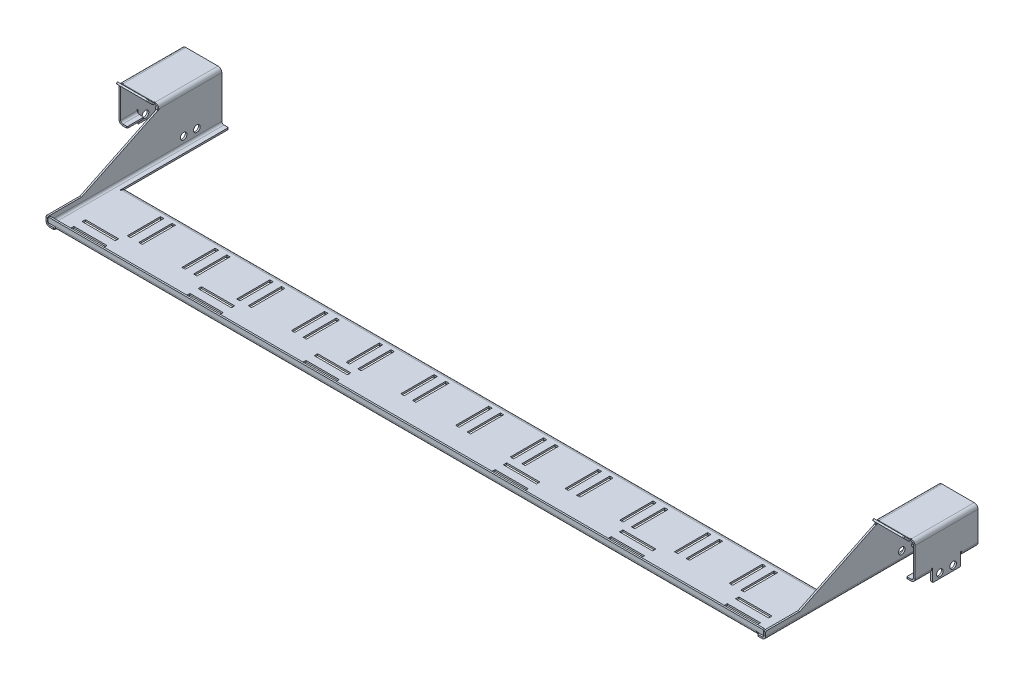
from build123d import *

# Parameters (mm, degrees)
BASE_FLANGE1_DEPTH              = 1
EDGE_FLANGE2_STRIP_W            = 6.6
EDGE_FLANGE2_STRIP_H            = 1
EDGE_FLANGE2_STRIP_CUT_DEPTH    = 105
EDGE_FLANGE2_STRIP_2_W          = 6.6
EDGE_FLANGE2_STRIP_2_H          = 1
EDGE_FLANGE2_STRIP_CUT_2_DEPTH  = 105
EDGE_FLANGE2_DEPTH              = 105
EDGE_FLANGE2_BEND_DEPTH         = 105
EDGE_FLANGE3_STRIP_W            = 6.6
EDGE_FLANGE3_STRIP_H            = 1
EDGE_FLANGE3_STRIP_CUT_DEPTH    = 38
EDGE_FLANGE3_RELIEF_W           = 7.1
EDGE_FLANGE3_RELIEF_H           = 0.5
EDGE_FLANGE3_RELIEF_CUT_DEPTH   = 1
EDGE_FLANGE3_STRIP_2_W          = 6.6
EDGE_FLANGE3_STRIP_2_H          = 1
EDGE_FLANGE3_STRIP_CUT_2_DEPTH  = 38
EDGE_FLANGE3_RELIEF_2_W         = 7.1
EDGE_FLANGE3_RELIEF_2_H         = 0.5
EDGE_FLANGE3_RELIEF_CUT_2_DEPTH = 1
EDGE_FLANGE3_DEPTH              = 38
EDGE_FLANGE3_BEND_DEPTH         = 38
EDGE_FLANGE4_STRIP_W            = 6.6
EDGE_FLANGE4_STRIP_H            = 1
EDGE_FLANGE4_STRIP_CUT_DEPTH    = 38
EDGE_FLANGE4_STRIP_2_W          = 6.6
EDGE_FLANGE4_STRIP_2_H          = 1
EDGE_FLANGE4_STRIP_CUT_2_DEPTH  = 38
EDGE_FLANGE4_DEPTH              = 38
EDGE_FLANGE4_BEND_DEPTH         = 38
SKETCH31_W                      = 0.5
SKETCH31_H                      = 1.5
CUT_EXTRUDE1_DEPTH              = 264.564033965
EDGE_FLANGE5_STRIP_W            = 6.6
EDGE_FLANGE5_STRIP_H            = 1
EDGE_FLANGE5_STRIP_CUT_DEPTH    = 423
EDGE_FLANGE5_RELIEF_W           = 7.1
EDGE_FLANGE5_RELIEF_H           = 0.5
EDGE_FLANGE5_RELIEF_CUT_DEPTH   = 1
EDGE_FLANGE5_DEPTH              = 423
SKETCH38_W                      = 0.5
SKETCH38_H                      = 1.5
CUT_EXTRUDE2_DEPTH              = 264.564033965
EDGE_FLANGE7_STRIP_W            = 6.6
EDGE_FLANGE7_STRIP_H            = 1
EDGE_FLANGE7_STRIP_CUT_DEPTH    = 423
EDGE_FLANGE7_RELIEF_W           = 7.1
EDGE_FLANGE7_RELIEF_H           = 0.5
EDGE_FLANGE7_RELIEF_CUT_DEPTH   = 1
EDGE_FLANGE7_DEPTH              = 423
CUT_EXTRUDE3_REACH              = 494.205
SKETCH42_W                      = 10.5
SKETCH42_H                      = 5
CUT_EXTRUDE4_REACH              = 494.205
SKETCH44_W                      = 0.5
SKETCH44_H                      = 1.5
EDGE_FLANGE8_STRIP_W            = 6.6
EDGE_FLANGE8_STRIP_H            = 1
EDGE_FLANGE8_STRIP_CUT_DEPTH    = 10
EDGE_FLANGE8_RELIEF_W           = 7.1
EDGE_FLANGE8_RELIEF_H           = 0.5
EDGE_FLANGE8_RELIEF_CUT_DEPTH   = 1
EDGE_FLANGE8_STRIP_2_W          = 6.6
EDGE_FLANGE8_STRIP_2_H          = 1
EDGE_FLANGE8_STRIP_CUT_2_DEPTH  = 10
EDGE_FLANGE8_RELIEF_2_W         = 7.1
EDGE_FLANGE8_RELIEF_2_H         = 0.5
EDGE_FLANGE8_RELIEF_CUT_2_DEPTH = 1
EDGE_FLANGE8_DEPTH              = 10
EDGE_FLANGE8_BEND_DEPTH         = 10
CUT_EXTRUDE5_REACH              = 494.205
SKETCH51_W                      = 10.5
SKETCH51_H                      = 5
CUT_EXTRUDE6_REACH              = 494.205
SKETCH52_W                      = 0.5
SKETCH52_H                      = 1.5
EDGE_FLANGE9_STRIP_W            = 6.6
EDGE_FLANGE9_STRIP_H            = 1
EDGE_FLANGE9_STRIP_CUT_DEPTH    = 10
EDGE_FLANGE9_RELIEF_W           = 7.1
EDGE_FLANGE9_RELIEF_H           = 0.5
EDGE_FLANGE9_RELIEF_CUT_DEPTH   = 1
EDGE_FLANGE9_STRIP_2_W          = 6.6
EDGE_FLANGE9_STRIP_2_H          = 1
EDGE_FLANGE9_STRIP_CUT_2_DEPTH  = 10
EDGE_FLANGE9_RELIEF_2_W         = 7.1
EDGE_FLANGE9_RELIEF_2_H         = 0.5
EDGE_FLANGE9_RELIEF_CUT_2_DEPTH = 1
EDGE_FLANGE9_DEPTH              = 10
EDGE_FLANGE9_BEND_DEPTH         = 10
CUT_EXTRUDE8_REACH              = 266.161
SKETCH67_W                      = 0.2
SKETCH67_H                      = 0.3
EDGE_FLANGE11_DEPTH             = 18.8
EDGE_FLANGE11_BEND_DEPTH        = 18.8
SKETCH73_R                      = 2
CUT_EXTRUDE9_DEPTH              = 493.406933215
CUT_EXTRUDE11_REACH             = 265.941
SKETCH75_W                      = 20
SKETCH75_H                      = 2
CUT_EXTRUDE13_REACH             = 472.014
FILLET1_R                       = 0.5
BOSS_EXTRUDE1_DEPTH             = 1
FILLET3_R                       = 0.5
CUT_EXTRUDE14_REACH             = 265.941
SKETCH80_W                      = 2
SKETCH80_H                      = 20


# Sheet-metal steps are written as plain solids
with BuildPart() as part:
    # Sketch1 → Base-Flange1 (new body)
    with BuildSketch(Plane(origin=(0, 0, 0), x_dir=(1, 0, 0), z_dir=(0, 1, 0))):
        Polygon((217, 0), (-217, 0), (-217, 105), (-212, 105), (-212, 42.5), (212, 42.5), (212, 105), (217, 105), align=None)
    extrude(amount=-BASE_FLANGE1_DEPTH)

    # Edge-Flange2 strip (across the edge) → Edge-Flange2 strip cut (cut)
    with BuildSketch(Plane(origin=(217, 0, 0), x_dir=(-1, 0, 0), z_dir=(0, 0, -1))):
        with Locations((-1, -0.5)):
            Rectangle(EDGE_FLANGE2_STRIP_W, EDGE_FLANGE2_STRIP_H)
    extrude(amount=EDGE_FLANGE2_STRIP_CUT_DEPTH, mode=Mode.SUBTRACT)

    # Edge-Flange2 strip 2 (across the edge) → Edge-Flange2 strip cut 2 (cut)
    with BuildSketch(Plane(origin=(-217, 0, -105), x_dir=(1, 0, 0), z_dir=(0, 0, 1))):
        with Locations((-1, -0.5)):
            Rectangle(EDGE_FLANGE2_STRIP_2_W, EDGE_FLANGE2_STRIP_2_H)
    extrude(amount=EDGE_FLANGE2_STRIP_CUT_2_DEPTH, mode=Mode.SUBTRACT)

    # Edge-Flange2 section (across the edge) → Edge-Flange2 (add)
    with BuildSketch(Plane(origin=(217, 0, 0), x_dir=(-1, 0, 0), z_dir=(0, 0, -1))):
        with BuildLine():
            Line((0, 1.3), (0, 29))
            Line((0, 29), (1, 29))
            Line((1, 29), (1, 1.3))
            ThreePointArc((1, 1.3), (1.380761184, 0.380761184), (2.3, 0))
            Line((2.3, 0), (2.3, -1))
            ThreePointArc((2.3, -1), (0.673654403, -0.326345597), (0, 1.3))
        make_face()
    extrude(amount=EDGE_FLANGE2_DEPTH)

    # Edge-Flange2 section 2 (across the edge) → Edge-Flange2 bend (add)
    with BuildSketch(Plane(origin=(-217, 0, -105), x_dir=(1, 0, 0), z_dir=(0, 0, 1))):
        with BuildLine():
            Line((0, 1.3), (0, 29))
            Line((0, 29), (1, 29))
            Line((1, 29), (1, 1.3))
            ThreePointArc((1, 1.3), (1.380761184, 0.380761184), (2.3, 0))
            Line((2.3, 0), (2.3, -1))
            ThreePointArc((2.3, -1), (0.673654403, -0.326345597), (0, 1.3))
        make_face()
    extrude(amount=EDGE_FLANGE2_BEND_DEPTH)

    # Edge-Flange3 strip (across the edge) → Edge-Flange3 strip cut (cut)
    with BuildSketch(Plane(origin=(217, 29, -105), x_dir=(0, -1, 0), z_dir=(0, 0, 1))):
        with Locations((-1, -0.5)):
            Rectangle(EDGE_FLANGE3_STRIP_W, EDGE_FLANGE3_STRIP_H)
    extrude(amount=EDGE_FLANGE3_STRIP_CUT_DEPTH, mode=Mode.SUBTRACT)

    # Edge-Flange3 relief (on the sheet) → Edge-Flange3 relief cut (cut)
    with BuildSketch(Plane(origin=(217, 26.7, -105), x_dir=(0, -1, 0), z_dir=(1, 0, 0))):
        with Locations((-3.05, -38.25)):
            Rectangle(EDGE_FLANGE3_RELIEF_W, EDGE_FLANGE3_RELIEF_H)
    extrude(amount=-EDGE_FLANGE3_RELIEF_CUT_DEPTH, mode=Mode.SUBTRACT)

    # Edge-Flange3 strip 2 (across the edge) → Edge-Flange3 strip cut 2 (cut)
    with BuildSketch(Plane(origin=(-217, 29, -67), x_dir=(0, -1, 0), z_dir=(0, 0, -1))):
        with Locations((-1, -0.5)):
            Rectangle(EDGE_FLANGE3_STRIP_2_W, EDGE_FLANGE3_STRIP_2_H)
    extrude(amount=EDGE_FLANGE3_STRIP_CUT_2_DEPTH, mode=Mode.SUBTRACT)

    # Edge-Flange3 relief 2 (on the sheet) → Edge-Flange3 relief cut 2 (cut)
    with BuildSketch(Plane(origin=(-217, 26.7, -67), x_dir=(0, -1, 0), z_dir=(-1, 0, 0))):
        with Locations((-3.05, 0.25)):
            Rectangle(EDGE_FLANGE3_RELIEF_2_W, EDGE_FLANGE3_RELIEF_2_H)
    extrude(amount=-EDGE_FLANGE3_RELIEF_CUT_2_DEPTH, mode=Mode.SUBTRACT)

    # Edge-Flange3 section (across the edge) → Edge-Flange3 (add)
    with BuildSketch(Plane(origin=(217, 29, -105), x_dir=(0, -1, 0), z_dir=(0, 0, 1))):
        with BuildLine():
            Line((0, 1.3), (0, 23))
            Line((0, 23), (1, 23))
            Line((1, 23), (1, 1.3))
            ThreePointArc((1, 1.3), (1.380761184, 0.380761184), (2.3, 0))
            Line((2.3, 0), (2.3, -1))
            ThreePointArc((2.3, -1), (0.673654403, -0.326345597), (0, 1.3))
        make_face()
    extrude(amount=EDGE_FLANGE3_DEPTH)

    # Edge-Flange3 section 2 (across the edge) → Edge-Flange3 bend (add)
    with BuildSketch(Plane(origin=(-217, 29, -67), x_dir=(0, -1, 0), z_dir=(0, 0, -1))):
        with BuildLine():
            Line((0, 1.3), (0, 23))
            Line((0, 23), (1, 23))
            Line((1, 23), (1, 1.3))
            ThreePointArc((1, 1.3), (1.380761184, 0.380761184), (2.3, 0))
            Line((2.3, 0), (2.3, -1))
            ThreePointArc((2.3, -1), (0.673654403, -0.326345597), (0, 1.3))
        make_face()
    extrude(amount=EDGE_FLANGE3_BEND_DEPTH)

    # Edge-Flange4 strip (across the edge) → Edge-Flange4 strip cut (cut)
    with BuildSketch(Plane(origin=(240, 28, -105), x_dir=(-1, 0, 0), z_dir=(0, 0, 1))):
        with Locations((-1, -0.5)):
            Rectangle(EDGE_FLANGE4_STRIP_W, EDGE_FLANGE4_STRIP_H)
    extrude(amount=EDGE_FLANGE4_STRIP_CUT_DEPTH, mode=Mode.SUBTRACT)

    # Edge-Flange4 strip 2 (across the edge) → Edge-Flange4 strip cut 2 (cut)
    with BuildSketch(Plane(origin=(-240, 28, -67), x_dir=(1, 0, 0), z_dir=(0, 0, -1))):
        with Locations((-1, -0.5)):
            Rectangle(EDGE_FLANGE4_STRIP_2_W, EDGE_FLANGE4_STRIP_2_H)
    extrude(amount=EDGE_FLANGE4_STRIP_CUT_2_DEPTH, mode=Mode.SUBTRACT)

    # Edge-Flange4 section (across the edge) → Edge-Flange4 (add)
    with BuildSketch(Plane(origin=(240, 28, -105), x_dir=(-1, 0, 0), z_dir=(0, 0, 1))):
        with BuildLine():
            Line((0, 1.3), (0, 26))
            Line((0, 26), (1, 26))
            Line((1, 26), (1, 1.3))
            ThreePointArc((1, 1.3), (1.380761184, 0.380761184), (2.3, 0))
            Line((2.3, 0), (2.3, -1))
            ThreePointArc((2.3, -1), (0.673654403, -0.326345597), (0, 1.3))
        make_face()
    extrude(amount=EDGE_FLANGE4_DEPTH)

    # Edge-Flange4 section 2 (across the edge) → Edge-Flange4 bend (add)
    with BuildSketch(Plane(origin=(-240, 28, -67), x_dir=(1, 0, 0), z_dir=(0, 0, -1))):
        with BuildLine():
            Line((0, 1.3), (0, 26))
            Line((0, 26), (1, 26))
            Line((1, 26), (1, 1.3))
            ThreePointArc((1, 1.3), (1.380761184, 0.380761184), (2.3, 0))
            Line((2.3, 0), (2.3, -1))
            ThreePointArc((2.3, -1), (0.673654403, -0.326345597), (0, 1.3))
        make_face()
    extrude(amount=EDGE_FLANGE4_BEND_DEPTH)

    # Sketch31 → Cut-Extrude1 (cut, through all)
    with BuildSketch(Plane(origin=(0, 0, 0), x_dir=(1, 0, 0), z_dir=(0, 1, 0))):
        with Locations((-211.75, 41.75)):
            Rectangle(SKETCH31_W, SKETCH31_H)
        with Locations((211.75, 41.75)):
            Rectangle(SKETCH31_W, SKETCH31_H)
    extrude(amount=-CUT_EXTRUDE1_DEPTH, mode=Mode.SUBTRACT)

    # Edge-Flange5 strip (across the edge) → Edge-Flange5 strip cut (cut)
    with BuildSketch(Plane(origin=(-211.5, -1, -42.5), x_dir=(0, 0, 1), z_dir=(1, 0, 0))):
        with Locations((-1, -0.5)):
            Rectangle(EDGE_FLANGE5_STRIP_W, EDGE_FLANGE5_STRIP_H)
    extrude(amount=EDGE_FLANGE5_STRIP_CUT_DEPTH, mode=Mode.SUBTRACT)

    # Edge-Flange5 relief (on the sheet) → Edge-Flange5 relief cut (cut)
    with BuildSketch(Plane(origin=(-211.5, -1, -40.2), x_dir=(0, 0, 1), z_dir=(0, -1, 0))):
        with Locations((-3.05, 0.25)):
            Rectangle(EDGE_FLANGE5_RELIEF_W, EDGE_FLANGE5_RELIEF_H)
        with Locations((-3.05, -423.25)):
            Rectangle(EDGE_FLANGE5_RELIEF_W, EDGE_FLANGE5_RELIEF_H)
    extrude(amount=-EDGE_FLANGE5_RELIEF_CUT_DEPTH, mode=Mode.SUBTRACT)

    # Edge-Flange5 section (across the edge) → Edge-Flange5 (add)
    with BuildSketch(Plane(origin=(-211.5, -1, -42.5), x_dir=(0, 0, 1), z_dir=(1, 0, 0))):
        with BuildLine():
            Line((0, 1.3), (0, 4))
            Line((0, 4), (1, 4))
            Line((1, 4), (1, 1.3))
            ThreePointArc((1, 1.3), (1.380761184, 0.380761184), (2.3, 0))
            Line((2.3, 0), (2.3, -1))
            ThreePointArc((2.3, -1), (0.673654403, -0.326345597), (0, 1.3))
        make_face()
    extrude(amount=EDGE_FLANGE5_DEPTH)

    # Sketch38 → Cut-Extrude2 (cut, through all)
    with BuildSketch(Plane(origin=(0, 0, 0), x_dir=(1, 0, 0), z_dir=(0, 1, 0))):
        with Locations((-211.75, 0.75)):
            Rectangle(SKETCH38_W, SKETCH38_H)
        with Locations((211.75, 0.75)):
            Rectangle(SKETCH38_W, SKETCH38_H)
    extrude(amount=-CUT_EXTRUDE2_DEPTH, mode=Mode.SUBTRACT)

    # Edge-Flange7 strip (across the edge) → Edge-Flange7 strip cut (cut)
    with BuildSketch(Plane(origin=(-211.5, 0, 0), x_dir=(0, 0, -1), z_dir=(1, 0, 0))):
        with Locations((-1, -0.5)):
            Rectangle(EDGE_FLANGE7_STRIP_W, EDGE_FLANGE7_STRIP_H)
    extrude(amount=EDGE_FLANGE7_STRIP_CUT_DEPTH, mode=Mode.SUBTRACT)

    # Edge-Flange7 relief (on the sheet) → Edge-Flange7 relief cut (cut)
    with BuildSketch(Plane(origin=(-211.5, 0, -2.3), x_dir=(0, 0, -1), z_dir=(0, 1, 0))):
        with Locations((-3.05, 0.25)):
            Rectangle(EDGE_FLANGE7_RELIEF_W, EDGE_FLANGE7_RELIEF_H)
        with Locations((-3.05, -423.25)):
            Rectangle(EDGE_FLANGE7_RELIEF_W, EDGE_FLANGE7_RELIEF_H)
    extrude(amount=-EDGE_FLANGE7_RELIEF_CUT_DEPTH, mode=Mode.SUBTRACT)

    # Edge-Flange7 section (across the edge) → Edge-Flange7 (add)
    with BuildSketch(Plane(origin=(-211.5, 0, 0), x_dir=(0, 0, -1), z_dir=(1, 0, 0))):
        with BuildLine():
            Line((0, 1.3), (0, 4))
            Line((0, 4), (1, 4))
            Line((1, 4), (1, 1.3))
            ThreePointArc((1, 1.3), (1.380761184, 0.380761184), (2.3, 0))
            Line((2.3, 0), (2.3, -1))
            ThreePointArc((2.3, -1), (0.673654403, -0.326345597), (0, 1.3))
        make_face()
    extrude(amount=EDGE_FLANGE7_DEPTH)

    # Sketch42 → Cut-Extrude3 (cut, up to next)
    with BuildSketch(Plane.ZY.offset(240), mode=Mode.PRIVATE) as cut_extrude3_sk1:
        with Locations((-99.75, 4.5)):
            Rectangle(SKETCH42_W, SKETCH42_H)
    cut_extrude3_tool1 = extrude(cut_extrude3_sk1.sketch, amount=-CUT_EXTRUDE3_REACH, mode=Mode.PRIVATE) & part.part
    # Sketch42 → Cut-Extrude3 (cut, up to next)
    with BuildSketch(Plane.ZY.offset(240), mode=Mode.PRIVATE) as cut_extrude3_sk2:
        with Locations((-72.25, 4.5)):
            Rectangle(SKETCH42_W, SKETCH42_H)
    cut_extrude3_tool2 = extrude(cut_extrude3_sk2.sketch, amount=-CUT_EXTRUDE3_REACH, mode=Mode.PRIVATE) & part.part
    add(cut_extrude3_tool1.solids().sort_by_distance((-240, 4.5, -99.75))[0], mode=Mode.SUBTRACT)
    add(cut_extrude3_tool2.solids().sort_by_distance((-240, 4.5, -72.25))[0], mode=Mode.SUBTRACT)

    # Sketch44 → Cut-Extrude4 (cut, up to next)
    with BuildSketch(Plane.ZY.offset(240), mode=Mode.PRIVATE) as cut_extrude4_sk1:
        with Locations((-94.75, 7.75)):
            Rectangle(SKETCH44_W, SKETCH44_H)
    cut_extrude4_tool1 = extrude(cut_extrude4_sk1.sketch, amount=-CUT_EXTRUDE4_REACH, mode=Mode.PRIVATE) & part.part
    # Sketch44 → Cut-Extrude4 (cut, up to next)
    with BuildSketch(Plane.ZY.offset(240), mode=Mode.PRIVATE) as cut_extrude4_sk2:
        with Locations((-77.25, 7.75)):
            Rectangle(SKETCH44_W, SKETCH44_H)
    cut_extrude4_tool2 = extrude(cut_extrude4_sk2.sketch, amount=-CUT_EXTRUDE4_REACH, mode=Mode.PRIVATE) & part.part
    add(cut_extrude4_tool1.solids().sort_by_distance((-240, 7.75, -94.75))[0], mode=Mode.SUBTRACT)
    add(cut_extrude4_tool2.solids().sort_by_distance((-240, 7.75, -77.25))[0], mode=Mode.SUBTRACT)

    # Edge-Flange8 strip (across the edge) → Edge-Flange8 strip cut (cut)
    with BuildSketch(Plane(origin=(-239, 7, -95), x_dir=(0, 1, 0), z_dir=(0, 0, -1))):
        with Locations((-1, -0.5)):
            Rectangle(EDGE_FLANGE8_STRIP_W, EDGE_FLANGE8_STRIP_H)
    extrude(amount=EDGE_FLANGE8_STRIP_CUT_DEPTH, mode=Mode.SUBTRACT)

    # Edge-Flange8 relief (on the sheet) → Edge-Flange8 relief cut (cut)
    with BuildSketch(Plane(origin=(-239, 9.3, -95), x_dir=(0, 1, 0), z_dir=(1, 0, 0))):
        with Locations((-3.05, 0.25)):
            Rectangle(EDGE_FLANGE8_RELIEF_W, EDGE_FLANGE8_RELIEF_H)
    extrude(amount=-EDGE_FLANGE8_RELIEF_CUT_DEPTH, mode=Mode.SUBTRACT)

    # Edge-Flange8 strip 2 (across the edge) → Edge-Flange8 strip cut 2 (cut)
    with BuildSketch(Plane(origin=(-239, 7, -67), x_dir=(0, 1, 0), z_dir=(0, 0, -1))):
        with Locations((-1, -0.5)):
            Rectangle(EDGE_FLANGE8_STRIP_2_W, EDGE_FLANGE8_STRIP_2_H)
    extrude(amount=EDGE_FLANGE8_STRIP_CUT_2_DEPTH, mode=Mode.SUBTRACT)

    # Edge-Flange8 relief 2 (on the sheet) → Edge-Flange8 relief cut 2 (cut)
    with BuildSketch(Plane(origin=(-239, 9.3, -67), x_dir=(0, 1, 0), z_dir=(1, 0, 0))):
        with Locations((-3.05, -10.25)):
            Rectangle(EDGE_FLANGE8_RELIEF_2_W, EDGE_FLANGE8_RELIEF_2_H)
    extrude(amount=-EDGE_FLANGE8_RELIEF_CUT_2_DEPTH, mode=Mode.SUBTRACT)

    # Edge-Flange8 section (across the edge) → Edge-Flange8 (add)
    with BuildSketch(Plane(origin=(-239, 7, -95), x_dir=(0, 1, 0), z_dir=(0, 0, -1))):
        with BuildLine():
            Line((0, 1.3), (0, 4))
            Line((0, 4), (1, 4))
            Line((1, 4), (1, 1.3))
            ThreePointArc((1, 1.3), (1.380761184, 0.380761184), (2.3, 0))
            Line((2.3, 0), (2.3, -1))
            ThreePointArc((2.3, -1), (0.673654403, -0.326345597), (0, 1.3))
        make_face()
    extrude(amount=EDGE_FLANGE8_DEPTH)

    # Edge-Flange8 section 2 (across the edge) → Edge-Flange8 bend (add)
    with BuildSketch(Plane(origin=(-239, 7, -67), x_dir=(0, 1, 0), z_dir=(0, 0, -1))):
        with BuildLine():
            Line((0, 1.3), (0, 4))
            Line((0, 4), (1, 4))
            Line((1, 4), (1, 1.3))
            ThreePointArc((1, 1.3), (1.380761184, 0.380761184), (2.3, 0))
            Line((2.3, 0), (2.3, -1))
            ThreePointArc((2.3, -1), (0.673654403, -0.326345597), (0, 1.3))
        make_face()
    extrude(amount=EDGE_FLANGE8_BEND_DEPTH)

    # Sketch51 → Cut-Extrude5 (cut, up to next)
    with BuildSketch(Plane(origin=(240, 0, 0), x_dir=(0, 0, -1), z_dir=(1, 0, 0)), mode=Mode.PRIVATE) as cut_extrude5_sk1:
        with Locations((72.25, 4.5)):
            Rectangle(SKETCH51_W, SKETCH51_H)
    cut_extrude5_tool1 = extrude(cut_extrude5_sk1.sketch, amount=-CUT_EXTRUDE5_REACH, mode=Mode.PRIVATE) & part.part
    # Sketch51 → Cut-Extrude5 (cut, up to next)
    with BuildSketch(Plane(origin=(240, 0, 0), x_dir=(0, 0, -1), z_dir=(1, 0, 0)), mode=Mode.PRIVATE) as cut_extrude5_sk2:
        with Locations((99.75, 4.5)):
            Rectangle(SKETCH51_W, SKETCH51_H)
    cut_extrude5_tool2 = extrude(cut_extrude5_sk2.sketch, amount=-CUT_EXTRUDE5_REACH, mode=Mode.PRIVATE) & part.part
    add(cut_extrude5_tool1.solids().sort_by_distance((240, 4.5, -72.25))[0], mode=Mode.SUBTRACT)
    add(cut_extrude5_tool2.solids().sort_by_distance((240, 4.5, -99.75))[0], mode=Mode.SUBTRACT)

    # Sketch52 → Cut-Extrude6 (cut, up to next)
    with BuildSketch(Plane(origin=(240, 0, 0), x_dir=(0, 0, -1), z_dir=(1, 0, 0)), mode=Mode.PRIVATE) as cut_extrude6_sk1:
        with Locations((77.25, 7.75)):
            Rectangle(SKETCH52_W, SKETCH52_H)
    cut_extrude6_tool1 = extrude(cut_extrude6_sk1.sketch, amount=-CUT_EXTRUDE6_REACH, mode=Mode.PRIVATE) & part.part
    # Sketch52 → Cut-Extrude6 (cut, up to next)
    with BuildSketch(Plane(origin=(240, 0, 0), x_dir=(0, 0, -1), z_dir=(1, 0, 0)), mode=Mode.PRIVATE) as cut_extrude6_sk2:
        with Locations((94.75, 7.75)):
            Rectangle(SKETCH52_W, SKETCH52_H)
    cut_extrude6_tool2 = extrude(cut_extrude6_sk2.sketch, amount=-CUT_EXTRUDE6_REACH, mode=Mode.PRIVATE) & part.part
    add(cut_extrude6_tool1.solids().sort_by_distance((240, 7.75, -77.25))[0], mode=Mode.SUBTRACT)
    add(cut_extrude6_tool2.solids().sort_by_distance((240, 7.75, -94.75))[0], mode=Mode.SUBTRACT)

    # Edge-Flange9 strip (across the edge) → Edge-Flange9 strip cut (cut)
    with BuildSketch(Plane(origin=(239, 7, -77), x_dir=(0, 1, 0), z_dir=(0, 0, 1))):
        with Locations((-1, -0.5)):
            Rectangle(EDGE_FLANGE9_STRIP_W, EDGE_FLANGE9_STRIP_H)
    extrude(amount=EDGE_FLANGE9_STRIP_CUT_DEPTH, mode=Mode.SUBTRACT)

    # Edge-Flange9 relief (on the sheet) → Edge-Flange9 relief cut (cut)
    with BuildSketch(Plane(origin=(239, 9.3, -77), x_dir=(0, 1, 0), z_dir=(-1, 0, 0))):
        with Locations((-3.05, 0.25)):
            Rectangle(EDGE_FLANGE9_RELIEF_W, EDGE_FLANGE9_RELIEF_H)
    extrude(amount=-EDGE_FLANGE9_RELIEF_CUT_DEPTH, mode=Mode.SUBTRACT)

    # Edge-Flange9 strip 2 (across the edge) → Edge-Flange9 strip cut 2 (cut)
    with BuildSketch(Plane(origin=(239, 7, -105), x_dir=(0, 1, 0), z_dir=(0, 0, 1))):
        with Locations((-1, -0.5)):
            Rectangle(EDGE_FLANGE9_STRIP_2_W, EDGE_FLANGE9_STRIP_2_H)
    extrude(amount=EDGE_FLANGE9_STRIP_CUT_2_DEPTH, mode=Mode.SUBTRACT)

    # Edge-Flange9 relief 2 (on the sheet) → Edge-Flange9 relief cut 2 (cut)
    with BuildSketch(Plane(origin=(239, 9.3, -105), x_dir=(0, 1, 0), z_dir=(-1, 0, 0))):
        with Locations((-3.05, -10.25)):
            Rectangle(EDGE_FLANGE9_RELIEF_2_W, EDGE_FLANGE9_RELIEF_2_H)
    extrude(amount=-EDGE_FLANGE9_RELIEF_CUT_2_DEPTH, mode=Mode.SUBTRACT)

    # Edge-Flange9 section (across the edge) → Edge-Flange9 (add)
    with BuildSketch(Plane(origin=(239, 7, -77), x_dir=(0, 1, 0), z_dir=(0, 0, 1))):
        with BuildLine():
            Line((0, 1.3), (0, 4))
            Line((0, 4), (1, 4))
            Line((1, 4), (1, 1.3))
            ThreePointArc((1, 1.3), (1.380761184, 0.380761184), (2.3, 0))
            Line((2.3, 0), (2.3, -1))
            ThreePointArc((2.3, -1), (0.673654403, -0.326345597), (0, 1.3))
        make_face()
    extrude(amount=EDGE_FLANGE9_DEPTH)

    # Edge-Flange9 section 2 (across the edge) → Edge-Flange9 bend (add)
    with BuildSketch(Plane(origin=(239, 7, -105), x_dir=(0, 1, 0), z_dir=(0, 0, 1))):
        with BuildLine():
            Line((0, 1.3), (0, 4))
            Line((0, 4), (1, 4))
            Line((1, 4), (1, 1.3))
            ThreePointArc((1, 1.3), (1.380761184, 0.380761184), (2.3, 0))
            Line((2.3, 0), (2.3, -1))
            ThreePointArc((2.3, -1), (0.673654403, -0.326345597), (0, 1.3))
        make_face()
    extrude(amount=EDGE_FLANGE9_BEND_DEPTH)

    # Sketch67 → Cut-Extrude8 (cut, up to next)
    with BuildSketch(Plane(origin=(0, 29, 0), x_dir=(1, 0, 0), z_dir=(0, 1, 0)), mode=Mode.PRIVATE) as cut_extrude8_sk1:
        with Locations((-237.5, 67.15)):
            Rectangle(SKETCH67_W, SKETCH67_H)
    cut_extrude8_tool1 = extrude(cut_extrude8_sk1.sketch, amount=-CUT_EXTRUDE8_REACH, mode=Mode.PRIVATE) & part.part
    # Sketch67 → Cut-Extrude8 (cut, up to next)
    with BuildSketch(Plane(origin=(0, 29, 0), x_dir=(1, 0, 0), z_dir=(0, 1, 0)), mode=Mode.PRIVATE) as cut_extrude8_sk2:
        with Locations((-218.5, 67.15)):
            Rectangle(SKETCH67_W, SKETCH67_H)
    cut_extrude8_tool2 = extrude(cut_extrude8_sk2.sketch, amount=-CUT_EXTRUDE8_REACH, mode=Mode.PRIVATE) & part.part
    # Sketch67 → Cut-Extrude8 (cut, up to next)
    with BuildSketch(Plane(origin=(0, 29, 0), x_dir=(1, 0, 0), z_dir=(0, 1, 0)), mode=Mode.PRIVATE) as cut_extrude8_sk3:
        with Locations((218.5, 67.15)):
            Rectangle(SKETCH67_W, SKETCH67_H)
    cut_extrude8_tool3 = extrude(cut_extrude8_sk3.sketch, amount=-CUT_EXTRUDE8_REACH, mode=Mode.PRIVATE) & part.part
    # Sketch67 → Cut-Extrude8 (cut, up to next)
    with BuildSketch(Plane(origin=(0, 29, 0), x_dir=(1, 0, 0), z_dir=(0, 1, 0)), mode=Mode.PRIVATE) as cut_extrude8_sk4:
        with Locations((237.5, 67.15)):
            Rectangle(SKETCH67_W, SKETCH67_H)
    cut_extrude8_tool4 = extrude(cut_extrude8_sk4.sketch, amount=-CUT_EXTRUDE8_REACH, mode=Mode.PRIVATE) & part.part
    add(cut_extrude8_tool1.solids().sort_by_distance((-237.5, 29, -67.15))[0], mode=Mode.SUBTRACT)
    add(cut_extrude8_tool2.solids().sort_by_distance((-218.5, 29, -67.15))[0], mode=Mode.SUBTRACT)
    add(cut_extrude8_tool3.solids().sort_by_distance((218.5, 29, -67.15))[0], mode=Mode.SUBTRACT)
    add(cut_extrude8_tool4.solids().sort_by_distance((237.5, 29, -67.15))[0], mode=Mode.SUBTRACT)

    # Edge-Flange11 section (across the edge) → Edge-Flange11 (add)
    with BuildSketch(Plane(origin=(-237.4, 29, -66.461522369), x_dir=(0, 0.7071067811865512, -0.7071067811865438), z_dir=(1, 0, 0))):
        with BuildLine():
            Line((-1, 0.538477631), (-1, 4.585786438))
            Line((-1, 4.585786438), (0, 4.585786438))
            Line((0, 4.585786438), (0, 0.538477631))
            ThreePointArc((0, 0.538477631), (0.098956608, 0.040989169), (0.380761184, -0.380761184))
            Line((0.380761184, -0.380761184), (-0.326345597, -1.087867966))
            ThreePointArc((-0.326345597, -1.087867966), (-0.824922925, -0.341694263), (-1, 0.538477631))
        make_face()
    extrude(amount=EDGE_FLANGE11_DEPTH)

    # Edge-Flange11 section 2 (across the edge) → Edge-Flange11 bend (add)
    with BuildSketch(Plane(origin=(218.6, 29, -66.461522369), x_dir=(0, 0.7071067811865512, -0.7071067811865438), z_dir=(1, 0, 0))):
        with BuildLine():
            Line((-1, 0.538477631), (-1, 4.585786438))
            Line((-1, 4.585786438), (0, 4.585786438))
            Line((0, 4.585786438), (0, 0.538477631))
            ThreePointArc((0, 0.538477631), (0.098956608, 0.040989169), (0.380761184, -0.380761184))
            Line((0.380761184, -0.380761184), (-0.326345597, -1.087867966))
            ThreePointArc((-0.326345597, -1.087867966), (-0.824922925, -0.341694263), (-1, 0.538477631))
        make_face()
    extrude(amount=EDGE_FLANGE11_BEND_DEPTH)

    # Sketch73 → Cut-Extrude9 (cut, through all)
    with BuildSketch(Plane.ZY.offset(240)):
        with Locations(Location((-90, 5, 0), (0, 0, 270))):
            Circle(SKETCH73_R)
        with Locations(Location((-82, 5, 0), (0, 0, 270))):
            Circle(SKETCH73_R)
    extrude(amount=-CUT_EXTRUDE9_DEPTH, mode=Mode.SUBTRACT)

    # Sketch75 → Cut-Extrude11 (cut, up to next)
    with BuildSketch(Plane(origin=(0, 0, 0), x_dir=(1, 0, 0), z_dir=(0, 1, 0)), mode=Mode.PRIVATE) as cut_extrude11_sk1:
        with Locations((-197, 12.8)):
            Rectangle(SKETCH75_W, SKETCH75_H)
    cut_extrude11_tool1 = extrude(cut_extrude11_sk1.sketch, amount=-CUT_EXTRUDE11_REACH, mode=Mode.PRIVATE) & part.part
    # Sketch75 → Cut-Extrude11 (cut, up to next)
    with BuildSketch(Plane(origin=(0, 0, 0), x_dir=(1, 0, 0), z_dir=(0, 1, 0)), mode=Mode.PRIVATE) as cut_extrude11_sk2:
        with Locations((-127, 12.8)):
            Rectangle(SKETCH75_W, SKETCH75_H)
    cut_extrude11_tool2 = extrude(cut_extrude11_sk2.sketch, amount=-CUT_EXTRUDE11_REACH, mode=Mode.PRIVATE) & part.part
    # Sketch75 → Cut-Extrude11 (cut, up to next)
    with BuildSketch(Plane(origin=(0, 0, 0), x_dir=(1, 0, 0), z_dir=(0, 1, 0)), mode=Mode.PRIVATE) as cut_extrude11_sk3:
        with Locations((-57, 12.8)):
            Rectangle(SKETCH75_W, SKETCH75_H)
    cut_extrude11_tool3 = extrude(cut_extrude11_sk3.sketch, amount=-CUT_EXTRUDE11_REACH, mode=Mode.PRIVATE) & part.part
    # Sketch75 → Cut-Extrude11 (cut, up to next)
    with BuildSketch(Plane(origin=(0, 0, 0), x_dir=(1, 0, 0), z_dir=(0, 1, 0)), mode=Mode.PRIVATE) as cut_extrude11_sk4:
        with Locations((57, 12.8)):
            Rectangle(SKETCH75_W, SKETCH75_H)
    cut_extrude11_tool4 = extrude(cut_extrude11_sk4.sketch, amount=-CUT_EXTRUDE11_REACH, mode=Mode.PRIVATE) & part.part
    # Sketch75 → Cut-Extrude11 (cut, up to next)
    with BuildSketch(Plane(origin=(0, 0, 0), x_dir=(1, 0, 0), z_dir=(0, 1, 0)), mode=Mode.PRIVATE) as cut_extrude11_sk5:
        with Locations((127, 12.8)):
            Rectangle(SKETCH75_W, SKETCH75_H)
    cut_extrude11_tool5 = extrude(cut_extrude11_sk5.sketch, amount=-CUT_EXTRUDE11_REACH, mode=Mode.PRIVATE) & part.part
    # Sketch75 → Cut-Extrude11 (cut, up to next)
    with BuildSketch(Plane(origin=(0, 0, 0), x_dir=(1, 0, 0), z_dir=(0, 1, 0)), mode=Mode.PRIVATE) as cut_extrude11_sk6:
        with Locations((197, 12.8)):
            Rectangle(SKETCH75_W, SKETCH75_H)
    cut_extrude11_tool6 = extrude(cut_extrude11_sk6.sketch, amount=-CUT_EXTRUDE11_REACH, mode=Mode.PRIVATE) & part.part
    # Sketch75 → Cut-Extrude11 (cut, up to next)
    with BuildSketch(Plane(origin=(0, 0, 0), x_dir=(1, 0, 0), z_dir=(0, 1, 0)), mode=Mode.PRIVATE) as cut_extrude11_sk7:
        with Locations((-197, 5.8)):
            Rectangle(SKETCH75_W, SKETCH75_H)
    cut_extrude11_tool7 = extrude(cut_extrude11_sk7.sketch, amount=-CUT_EXTRUDE11_REACH, mode=Mode.PRIVATE) & part.part
    # Sketch75 → Cut-Extrude11 (cut, up to next)
    with BuildSketch(Plane(origin=(0, 0, 0), x_dir=(1, 0, 0), z_dir=(0, 1, 0)), mode=Mode.PRIVATE) as cut_extrude11_sk8:
        with Locations((-127, 5.8)):
            Rectangle(SKETCH75_W, SKETCH75_H)
    cut_extrude11_tool8 = extrude(cut_extrude11_sk8.sketch, amount=-CUT_EXTRUDE11_REACH, mode=Mode.PRIVATE) & part.part
    # Sketch75 → Cut-Extrude11 (cut, up to next)
    with BuildSketch(Plane(origin=(0, 0, 0), x_dir=(1, 0, 0), z_dir=(0, 1, 0)), mode=Mode.PRIVATE) as cut_extrude11_sk9:
        with Locations((-57, 5.8)):
            Rectangle(SKETCH75_W, SKETCH75_H)
    cut_extrude11_tool9 = extrude(cut_extrude11_sk9.sketch, amount=-CUT_EXTRUDE11_REACH, mode=Mode.PRIVATE) & part.part
    # Sketch75 → Cut-Extrude11 (cut, up to next)
    with BuildSketch(Plane(origin=(0, 0, 0), x_dir=(1, 0, 0), z_dir=(0, 1, 0)), mode=Mode.PRIVATE) as cut_extrude11_sk10:
        with Locations((57, 5.8)):
            Rectangle(SKETCH75_W, SKETCH75_H)
    cut_extrude11_tool10 = extrude(cut_extrude11_sk10.sketch, amount=-CUT_EXTRUDE11_REACH, mode=Mode.PRIVATE) & part.part
    # Sketch75 → Cut-Extrude11 (cut, up to next)
    with BuildSketch(Plane(origin=(0, 0, 0), x_dir=(1, 0, 0), z_dir=(0, 1, 0)), mode=Mode.PRIVATE) as cut_extrude11_sk11:
        with Locations((127, 5.8)):
            Rectangle(SKETCH75_W, SKETCH75_H)
    cut_extrude11_tool11 = extrude(cut_extrude11_sk11.sketch, amount=-CUT_EXTRUDE11_REACH, mode=Mode.PRIVATE) & part.part
    # Sketch75 → Cut-Extrude11 (cut, up to next)
    with BuildSketch(Plane(origin=(0, 0, 0), x_dir=(1, 0, 0), z_dir=(0, 1, 0)), mode=Mode.PRIVATE) as cut_extrude11_sk12:
        with Locations((197, 5.8)):
            Rectangle(SKETCH75_W, SKETCH75_H)
    cut_extrude11_tool12 = extrude(cut_extrude11_sk12.sketch, amount=-CUT_EXTRUDE11_REACH, mode=Mode.PRIVATE) & part.part
    add(cut_extrude11_tool1.solids().sort_by_distance((-197, 0, -12.8))[0], mode=Mode.SUBTRACT)
    add(cut_extrude11_tool2.solids().sort_by_distance((-127, 0, -12.8))[0], mode=Mode.SUBTRACT)
    add(cut_extrude11_tool3.solids().sort_by_distance((-57, 0, -12.8))[0], mode=Mode.SUBTRACT)
    add(cut_extrude11_tool4.solids().sort_by_distance((57, 0, -12.8))[0], mode=Mode.SUBTRACT)
    add(cut_extrude11_tool5.solids().sort_by_distance((127, 0, -12.8))[0], mode=Mode.SUBTRACT)
    add(cut_extrude11_tool6.solids().sort_by_distance((197, 0, -12.8))[0], mode=Mode.SUBTRACT)
    add(cut_extrude11_tool7.solids().sort_by_distance((-197, 0, -5.8))[0], mode=Mode.SUBTRACT)
    add(cut_extrude11_tool8.solids().sort_by_distance((-127, 0, -5.8))[0], mode=Mode.SUBTRACT)
    add(cut_extrude11_tool9.solids().sort_by_distance((-57, 0, -5.8))[0], mode=Mode.SUBTRACT)
    add(cut_extrude11_tool10.solids().sort_by_distance((57, 0, -5.8))[0], mode=Mode.SUBTRACT)
    add(cut_extrude11_tool11.solids().sort_by_distance((127, 0, -5.8))[0], mode=Mode.SUBTRACT)
    add(cut_extrude11_tool12.solids().sort_by_distance((197, 0, -5.8))[0], mode=Mode.SUBTRACT)

    # Cut-Extrude13: up to this face of the body (flat: up to its plane)
    cut_extrude13_end = Plane(part.part.faces().sort_by_distance((217, 14.837854113, -51.14386988))[0])
    # Sketch78 → Cut-Extrude13 (cut, up to the picked face)
    with BuildSketch(Plane.ZY.offset(217), mode=Mode.PRIVATE) as cut_extrude13_sk1:
        Polygon((0, 4), (-20.5, 4), (-66.5, 26.2), (-66.5, 34), (0, 34), align=None)
    cut_extrude13_tool1 = split(extrude(cut_extrude13_sk1.sketch, amount=-CUT_EXTRUDE13_REACH, mode=Mode.PRIVATE), bisect_by=cut_extrude13_end, keep=Keep.BOTH, mode=Mode.PRIVATE)
    add(cut_extrude13_tool1.solids().sort_by(Axis((-217, 21.614228, -27.087072), (1, 0, 0)))[0], mode=Mode.SUBTRACT)

    # Fillet1
    fillet1_edges = [part.edges().sort_by_distance(p)[0] for p in [
        (-237.4, 31.889087297, -62.865328291),
        (-218.6, 31.889087297, -62.865328291),
        (218.6, 31.889087297, -62.865328291),
        (237.4, 31.889087297, -62.865328291),
        (-212, -0.5, -105),
        (212, -0.5, -105),
        (-216.5, 4, 0),
        (216.5, 4, 0),
        (-211.5, -5, -42),
        (211.5, -5, -42),
        (212, -0.5, 0),
        (-212, -0.5, 0),
        (-239.5, 2, -94.5),
        (-239.5, 2, -77.5),
        (-235, 7.5, -95),
        (-235, 7.5, -105),
        (-235, 7.5, -67),
        (-235, 7.5, -77),
        (239.5, 2, -77.5),
        (239.5, 2, -94.5),
        (235, 7.5, -77),
        (235, 7.5, -67),
        (235, 7.5, -105),
        (235, 7.5, -95),
    ]]
    fillet(fillet1_edges, radius=FILLET1_R)

    # Sketch79 → Boss-Extrude1 (add)
    with BuildSketch(Plane.XY):
        Polygon((-211.5, 4), (-215.7, 4), (-215.7, 1), (-211.7, 1), (-211.7, 1.5), (-211.5, 1.5), align=None)
        Polygon((211.5, 1.5), (211.5, 4), (215.7, 4), (215.7, 1), (211.7, 1), (211.7, 1.5), align=None)
    extrude(amount=-BOSS_EXTRUDE1_DEPTH)

    # Fillet3
    fillet3_edges = [part.edges().sort_by_distance(p)[0] for p in [
        (-215.7, 4, -0.5),
        (-215.7, 1, -0.5),
        (215.7, 1, -0.5),
        (215.7, 4, -0.5),
    ]]
    fillet(fillet3_edges, radius=FILLET3_R)

    # Sketch80 → Cut-Extrude14 (cut, up to next)
    with BuildSketch(Plane(origin=(0, 0, 0), x_dir=(1, 0, 0), z_dir=(0, 1, 0)), mode=Mode.PRIVATE) as cut_extrude14_sk1:
        with Locations((-185, 28)):
            Rectangle(SKETCH80_W, SKETCH80_H)
    cut_extrude14_tool1 = extrude(cut_extrude14_sk1.sketch, amount=-CUT_EXTRUDE14_REACH, mode=Mode.PRIVATE) & part.part
    # Sketch80 → Cut-Extrude14 (cut, up to next)
    with BuildSketch(Plane(origin=(0, 0, 0), x_dir=(1, 0, 0), z_dir=(0, 1, 0)), mode=Mode.PRIVATE) as cut_extrude14_sk2:
        with Locations((-178, 28)):
            Rectangle(SKETCH80_W, SKETCH80_H)
    cut_extrude14_tool2 = extrude(cut_extrude14_sk2.sketch, amount=-CUT_EXTRUDE14_REACH, mode=Mode.PRIVATE) & part.part
    # Sketch80 → Cut-Extrude14 (cut, up to next)
    with BuildSketch(Plane(origin=(0, 0, 0), x_dir=(1, 0, 0), z_dir=(0, 1, 0)), mode=Mode.PRIVATE) as cut_extrude14_sk3:
        with Locations((-152, 28)):
            Rectangle(SKETCH80_W, SKETCH80_H)
    cut_extrude14_tool3 = extrude(cut_extrude14_sk3.sketch, amount=-CUT_EXTRUDE14_REACH, mode=Mode.PRIVATE) & part.part
    # Sketch80 → Cut-Extrude14 (cut, up to next)
    with BuildSketch(Plane(origin=(0, 0, 0), x_dir=(1, 0, 0), z_dir=(0, 1, 0)), mode=Mode.PRIVATE) as cut_extrude14_sk4:
        with Locations((-145, 28)):
            Rectangle(SKETCH80_W, SKETCH80_H)
    cut_extrude14_tool4 = extrude(cut_extrude14_sk4.sketch, amount=-CUT_EXTRUDE14_REACH, mode=Mode.PRIVATE) & part.part
    # Sketch80 → Cut-Extrude14 (cut, up to next)
    with BuildSketch(Plane(origin=(0, 0, 0), x_dir=(1, 0, 0), z_dir=(0, 1, 0)), mode=Mode.PRIVATE) as cut_extrude14_sk5:
        with Locations((-119, 28)):
            Rectangle(SKETCH80_W, SKETCH80_H)
    cut_extrude14_tool5 = extrude(cut_extrude14_sk5.sketch, amount=-CUT_EXTRUDE14_REACH, mode=Mode.PRIVATE) & part.part
    # Sketch80 → Cut-Extrude14 (cut, up to next)
    with BuildSketch(Plane(origin=(0, 0, 0), x_dir=(1, 0, 0), z_dir=(0, 1, 0)), mode=Mode.PRIVATE) as cut_extrude14_sk6:
        with Locations((-112, 28)):
            Rectangle(SKETCH80_W, SKETCH80_H)
    cut_extrude14_tool6 = extrude(cut_extrude14_sk6.sketch, amount=-CUT_EXTRUDE14_REACH, mode=Mode.PRIVATE) & part.part
    # Sketch80 → Cut-Extrude14 (cut, up to next)
    with BuildSketch(Plane(origin=(0, 0, 0), x_dir=(1, 0, 0), z_dir=(0, 1, 0)), mode=Mode.PRIVATE) as cut_extrude14_sk7:
        with Locations((-86, 28)):
            Rectangle(SKETCH80_W, SKETCH80_H)
    cut_extrude14_tool7 = extrude(cut_extrude14_sk7.sketch, amount=-CUT_EXTRUDE14_REACH, mode=Mode.PRIVATE) & part.part
    # Sketch80 → Cut-Extrude14 (cut, up to next)
    with BuildSketch(Plane(origin=(0, 0, 0), x_dir=(1, 0, 0), z_dir=(0, 1, 0)), mode=Mode.PRIVATE) as cut_extrude14_sk8:
        with Locations((-79, 28)):
            Rectangle(SKETCH80_W, SKETCH80_H)
    cut_extrude14_tool8 = extrude(cut_extrude14_sk8.sketch, amount=-CUT_EXTRUDE14_REACH, mode=Mode.PRIVATE) & part.part
    # Sketch80 → Cut-Extrude14 (cut, up to next)
    with BuildSketch(Plane(origin=(0, 0, 0), x_dir=(1, 0, 0), z_dir=(0, 1, 0)), mode=Mode.PRIVATE) as cut_extrude14_sk9:
        with Locations((-53, 28)):
            Rectangle(SKETCH80_W, SKETCH80_H)
    cut_extrude14_tool9 = extrude(cut_extrude14_sk9.sketch, amount=-CUT_EXTRUDE14_REACH, mode=Mode.PRIVATE) & part.part
    # Sketch80 → Cut-Extrude14 (cut, up to next)
    with BuildSketch(Plane(origin=(0, 0, 0), x_dir=(1, 0, 0), z_dir=(0, 1, 0)), mode=Mode.PRIVATE) as cut_extrude14_sk10:
        with Locations((-46, 28)):
            Rectangle(SKETCH80_W, SKETCH80_H)
    cut_extrude14_tool10 = extrude(cut_extrude14_sk10.sketch, amount=-CUT_EXTRUDE14_REACH, mode=Mode.PRIVATE) & part.part
    # Sketch80 → Cut-Extrude14 (cut, up to next)
    with BuildSketch(Plane(origin=(0, 0, 0), x_dir=(1, 0, 0), z_dir=(0, 1, 0)), mode=Mode.PRIVATE) as cut_extrude14_sk11:
        with Locations((-20, 28)):
            Rectangle(SKETCH80_W, SKETCH80_H)
    cut_extrude14_tool11 = extrude(cut_extrude14_sk11.sketch, amount=-CUT_EXTRUDE14_REACH, mode=Mode.PRIVATE) & part.part
    # Sketch80 → Cut-Extrude14 (cut, up to next)
    with BuildSketch(Plane(origin=(0, 0, 0), x_dir=(1, 0, 0), z_dir=(0, 1, 0)), mode=Mode.PRIVATE) as cut_extrude14_sk12:
        with Locations((-13, 28)):
            Rectangle(SKETCH80_W, SKETCH80_H)
    cut_extrude14_tool12 = extrude(cut_extrude14_sk12.sketch, amount=-CUT_EXTRUDE14_REACH, mode=Mode.PRIVATE) & part.part
    # Sketch80 → Cut-Extrude14 (cut, up to next)
    with BuildSketch(Plane(origin=(0, 0, 0), x_dir=(1, 0, 0), z_dir=(0, 1, 0)), mode=Mode.PRIVATE) as cut_extrude14_sk13:
        with Locations((13, 28)):
            Rectangle(SKETCH80_W, SKETCH80_H)
    cut_extrude14_tool13 = extrude(cut_extrude14_sk13.sketch, amount=-CUT_EXTRUDE14_REACH, mode=Mode.PRIVATE) & part.part
    # Sketch80 → Cut-Extrude14 (cut, up to next)
    with BuildSketch(Plane(origin=(0, 0, 0), x_dir=(1, 0, 0), z_dir=(0, 1, 0)), mode=Mode.PRIVATE) as cut_extrude14_sk14:
        with Locations((20, 28)):
            Rectangle(SKETCH80_W, SKETCH80_H)
    cut_extrude14_tool14 = extrude(cut_extrude14_sk14.sketch, amount=-CUT_EXTRUDE14_REACH, mode=Mode.PRIVATE) & part.part
    # Sketch80 → Cut-Extrude14 (cut, up to next)
    with BuildSketch(Plane(origin=(0, 0, 0), x_dir=(1, 0, 0), z_dir=(0, 1, 0)), mode=Mode.PRIVATE) as cut_extrude14_sk15:
        with Locations((46, 28)):
            Rectangle(SKETCH80_W, SKETCH80_H)
    cut_extrude14_tool15 = extrude(cut_extrude14_sk15.sketch, amount=-CUT_EXTRUDE14_REACH, mode=Mode.PRIVATE) & part.part
    # Sketch80 → Cut-Extrude14 (cut, up to next)
    with BuildSketch(Plane(origin=(0, 0, 0), x_dir=(1, 0, 0), z_dir=(0, 1, 0)), mode=Mode.PRIVATE) as cut_extrude14_sk16:
        with Locations((53, 28)):
            Rectangle(SKETCH80_W, SKETCH80_H)
    cut_extrude14_tool16 = extrude(cut_extrude14_sk16.sketch, amount=-CUT_EXTRUDE14_REACH, mode=Mode.PRIVATE) & part.part
    # Sketch80 → Cut-Extrude14 (cut, up to next)
    with BuildSketch(Plane(origin=(0, 0, 0), x_dir=(1, 0, 0), z_dir=(0, 1, 0)), mode=Mode.PRIVATE) as cut_extrude14_sk17:
        with Locations((79, 28)):
            Rectangle(SKETCH80_W, SKETCH80_H)
    cut_extrude14_tool17 = extrude(cut_extrude14_sk17.sketch, amount=-CUT_EXTRUDE14_REACH, mode=Mode.PRIVATE) & part.part
    # Sketch80 → Cut-Extrude14 (cut, up to next)
    with BuildSketch(Plane(origin=(0, 0, 0), x_dir=(1, 0, 0), z_dir=(0, 1, 0)), mode=Mode.PRIVATE) as cut_extrude14_sk18:
        with Locations((86, 28)):
            Rectangle(SKETCH80_W, SKETCH80_H)
    cut_extrude14_tool18 = extrude(cut_extrude14_sk18.sketch, amount=-CUT_EXTRUDE14_REACH, mode=Mode.PRIVATE) & part.part
    # Sketch80 → Cut-Extrude14 (cut, up to next)
    with BuildSketch(Plane(origin=(0, 0, 0), x_dir=(1, 0, 0), z_dir=(0, 1, 0)), mode=Mode.PRIVATE) as cut_extrude14_sk19:
        with Locations((112, 28)):
            Rectangle(SKETCH80_W, SKETCH80_H)
    cut_extrude14_tool19 = extrude(cut_extrude14_sk19.sketch, amount=-CUT_EXTRUDE14_REACH, mode=Mode.PRIVATE) & part.part
    # Sketch80 → Cut-Extrude14 (cut, up to next)
    with BuildSketch(Plane(origin=(0, 0, 0), x_dir=(1, 0, 0), z_dir=(0, 1, 0)), mode=Mode.PRIVATE) as cut_extrude14_sk20:
        with Locations((119, 28)):
            Rectangle(SKETCH80_W, SKETCH80_H)
    cut_extrude14_tool20 = extrude(cut_extrude14_sk20.sketch, amount=-CUT_EXTRUDE14_REACH, mode=Mode.PRIVATE) & part.part
    # Sketch80 → Cut-Extrude14 (cut, up to next)
    with BuildSketch(Plane(origin=(0, 0, 0), x_dir=(1, 0, 0), z_dir=(0, 1, 0)), mode=Mode.PRIVATE) as cut_extrude14_sk21:
        with Locations((145, 28)):
            Rectangle(SKETCH80_W, SKETCH80_H)
    cut_extrude14_tool21 = extrude(cut_extrude14_sk21.sketch, amount=-CUT_EXTRUDE14_REACH, mode=Mode.PRIVATE) & part.part
    # Sketch80 → Cut-Extrude14 (cut, up to next)
    with BuildSketch(Plane(origin=(0, 0, 0), x_dir=(1, 0, 0), z_dir=(0, 1, 0)), mode=Mode.PRIVATE) as cut_extrude14_sk22:
        with Locations((152, 28)):
            Rectangle(SKETCH80_W, SKETCH80_H)
    cut_extrude14_tool22 = extrude(cut_extrude14_sk22.sketch, amount=-CUT_EXTRUDE14_REACH, mode=Mode.PRIVATE) & part.part
    # Sketch80 → Cut-Extrude14 (cut, up to next)
    with BuildSketch(Plane(origin=(0, 0, 0), x_dir=(1, 0, 0), z_dir=(0, 1, 0)), mode=Mode.PRIVATE) as cut_extrude14_sk23:
        with Locations((178, 28)):
            Rectangle(SKETCH80_W, SKETCH80_H)
    cut_extrude14_tool23 = extrude(cut_extrude14_sk23.sketch, amount=-CUT_EXTRUDE14_REACH, mode=Mode.PRIVATE) & part.part
    # Sketch80 → Cut-Extrude14 (cut, up to next)
    with BuildSketch(Plane(origin=(0, 0, 0), x_dir=(1, 0, 0), z_dir=(0, 1, 0)), mode=Mode.PRIVATE) as cut_extrude14_sk24:
        with Locations((185, 28)):
            Rectangle(SKETCH80_W, SKETCH80_H)
    cut_extrude14_tool24 = extrude(cut_extrude14_sk24.sketch, amount=-CUT_EXTRUDE14_REACH, mode=Mode.PRIVATE) & part.part
    add(cut_extrude14_tool1.solids().sort_by_distance((-185, 0, -28))[0], mode=Mode.SUBTRACT)
    add(cut_extrude14_tool2.solids().sort_by_distance((-178, 0, -28))[0], mode=Mode.SUBTRACT)
    add(cut_extrude14_tool3.solids().sort_by_distance((-152, 0, -28))[0], mode=Mode.SUBTRACT)
    add(cut_extrude14_tool4.solids().sort_by_distance((-145, 0, -28))[0], mode=Mode.SUBTRACT)
    add(cut_extrude14_tool5.solids().sort_by_distance((-119, 0, -28))[0], mode=Mode.SUBTRACT)
    add(cut_extrude14_tool6.solids().sort_by_distance((-112, 0, -28))[0], mode=Mode.SUBTRACT)
    add(cut_extrude14_tool7.solids().sort_by_distance((-86, 0, -28))[0], mode=Mode.SUBTRACT)
    add(cut_extrude14_tool8.solids().sort_by_distance((-79, 0, -28))[0], mode=Mode.SUBTRACT)
    add(cut_extrude14_tool9.solids().sort_by_distance((-53, 0, -28))[0], mode=Mode.SUBTRACT)
    add(cut_extrude14_tool10.solids().sort_by_distance((-46, 0, -28))[0], mode=Mode.SUBTRACT)
    add(cut_extrude14_tool11.solids().sort_by_distance((-20, 0, -28))[0], mode=Mode.SUBTRACT)
    add(cut_extrude14_tool12.solids().sort_by_distance((-13, 0, -28))[0], mode=Mode.SUBTRACT)
    add(cut_extrude14_tool13.solids().sort_by_distance((13, 0, -28))[0], mode=Mode.SUBTRACT)
    add(cut_extrude14_tool14.solids().sort_by_distance((20, 0, -28))[0], mode=Mode.SUBTRACT)
    add(cut_extrude14_tool15.solids().sort_by_distance((46, 0, -28))[0], mode=Mode.SUBTRACT)
    add(cut_extrude14_tool16.solids().sort_by_distance((53, 0, -28))[0], mode=Mode.SUBTRACT)
    add(cut_extrude14_tool17.solids().sort_by_distance((79, 0, -28))[0], mode=Mode.SUBTRACT)
    add(cut_extrude14_tool18.solids().sort_by_distance((86, 0, -28))[0], mode=Mode.SUBTRACT)
    add(cut_extrude14_tool19.solids().sort_by_distance((112, 0, -28))[0], mode=Mode.SUBTRACT)
    add(cut_extrude14_tool20.solids().sort_by_distance((119, 0, -28))[0], mode=Mode.SUBTRACT)
    add(cut_extrude14_tool21.solids().sort_by_distance((145, 0, -28))[0], mode=Mode.SUBTRACT)
    add(cut_extrude14_tool22.solids().sort_by_distance((152, 0, -28))[0], mode=Mode.SUBTRACT)
    add(cut_extrude14_tool23.solids().sort_by_distance((178, 0, -28))[0], mode=Mode.SUBTRACT)
    add(cut_extrude14_tool24.solids().sort_by_distance((185, 0, -28))[0], mode=Mode.SUBTRACT)


solid = part.part
